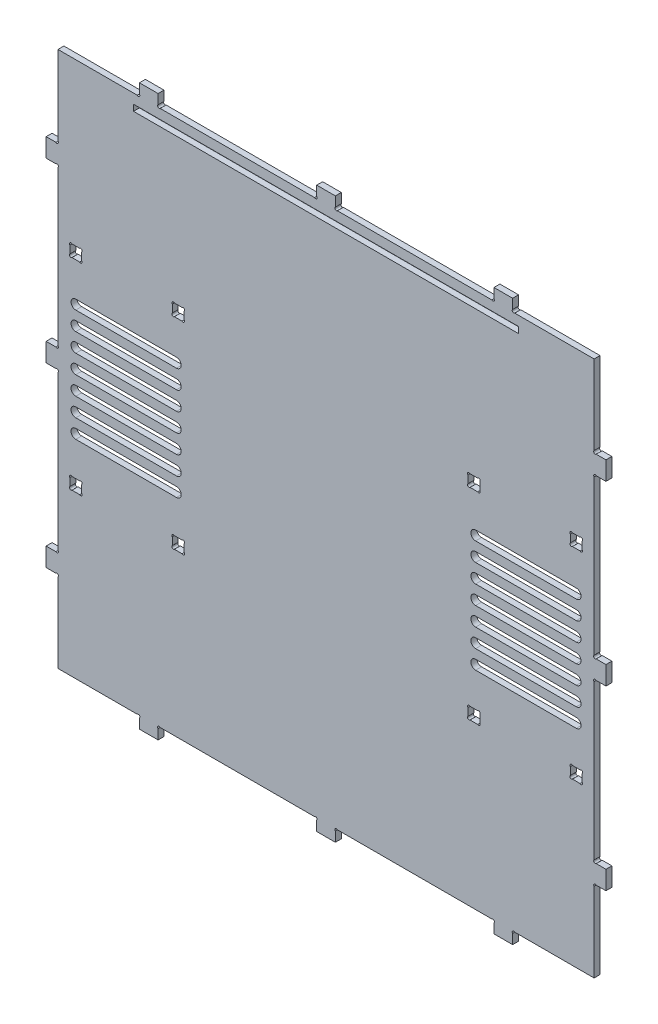
from build123d import *

# Parameters (mm, degrees)
SKETCH15_W                     = 287.299999948
SKETCH15_H                     = 287.299999948
BOSS_EXTRUDE10_DEPTH           = 3.175
SKETCH18_W                     = 206.375
SKETCH18_H                     = 3.302
SLOT_DEPTH                     = 3.175
SKETCH24_W                     = 10.000000066
SKETCH24_H                     = 6.35
TOOTH_DEPTH                    = 3.175
TOOTH_DB_D                     = 1.5875
TOOTH_PATTERN_SIDE_DEPTH       = 3.175
TOOTH_PATTERN_SIDE_2_DEPTH     = 3.175
TOOTH_PATTERN_FULL_DEPTH       = 3.175
TOOTH_PATTERN_FULL_2_DEPTH     = 3.175
CUT_EXTRUDE2_DEPTH             = 6.35
SKETCH37_W                     = 6.35
SKETCH37_H                     = 6.35
CUT_EXTRUDE3_DEPTH             = 6.35
F_1_16_0_0625_DIAMETER_HOLE1_D = 1.5875


# Read off the part's stored shape, not the designer's step: tooth_pattern_side, tooth_pattern_full
with BuildPart() as part:
    # Sketch15 → Boss-Extrude10 (new body)
    with BuildSketch(Plane.XY):
        with Locations((143.649999974, 143.649999974)):
            Rectangle(SKETCH15_W, SKETCH15_H)
    extrude(amount=BOSS_EXTRUDE10_DEPTH)

    # Sketch18 → slot (cut)
    with BuildSketch(Plane.XY.offset(3.175)):
        with Locations((143.649999974, 280.465831498)):
            Rectangle(SKETCH18_W, SKETCH18_H)
    extrude(amount=-SLOT_DEPTH, mode=Mode.SUBTRACT)

    # Sketch24 → tooth (add)
    with BuildSketch(Plane.XY):
        with Locations((143.649999974, 290.474999948)):
            Rectangle(SKETCH24_W, SKETCH24_H)
    extrude(amount=TOOTH_DEPTH)

    # tooth_db (through all)
    with Locations(Plane.XY.offset(3.175)):
        with Locations((138.091199941, 287.858799948), (149.208800007, 287.858799948)):
            Hole(TOOTH_DB_D / 2)

    # tooth_pattern_side outline → tooth_pattern_side (cut)
    with BuildSketch(Plane.XY):
        with BuildLine():
            Line((54.772521235, 287.299999948), (53.645078778, 287.299999948))
            ThreePointArc((53.645078778, 287.299999948), (54.208800007, 287.065049947), (54.772521235, 287.299999948))
        make_face()
        with BuildLine():
            ThreePointArc((42.527478713, 287.299999948), (43.091199941, 287.065049947), (43.65492117, 287.299999948))
            Line((43.65492117, 287.299999948), (42.527478713, 287.299999948))
        make_face()
        with BuildLine():
            Line((244.772521235, 287.299999948), (243.645078778, 287.299999948))
            ThreePointArc((243.645078778, 287.299999948), (244.208800007, 287.065049947), (244.772521235, 287.299999948))
        make_face()
        with BuildLine():
            ThreePointArc((232.527478713, 287.299999948), (233.091199941, 287.065049947), (233.65492117, 287.299999948))
            Line((233.65492117, 287.299999948), (232.527478713, 287.299999948))
        make_face()
    extrude(amount=TOOTH_PATTERN_SIDE_DEPTH, mode=Mode.SUBTRACT)

    # tooth_pattern_side 2 outline → tooth_pattern_side 2 (add)
    with BuildSketch(Plane.XY):
        with BuildLine():
            Line((53.650000007, 293.649999948), (43.649999941, 293.649999948))
            Line((43.649999941, 293.649999948), (43.649999941, 288.422521176))
            ThreePointArc((43.649999941, 288.422521176), (43.884942314, 287.862279782), (43.65492117, 287.299999948))
            Line((43.65492117, 287.299999948), (53.645078778, 287.299999948))
            ThreePointArc((53.645078778, 287.299999948), (53.415057634, 287.862279782), (53.650000007, 288.422521176))
            Line((53.650000007, 288.422521176), (53.650000007, 293.649999948))
        make_face()
        with BuildLine():
            Line((243.650000007, 293.649999948), (233.649999941, 293.649999948))
            Line((233.649999941, 293.649999948), (233.649999941, 288.422521176))
            ThreePointArc((233.649999941, 288.422521176), (233.884942314, 287.862279782), (233.65492117, 287.299999948))
            Line((233.65492117, 287.299999948), (243.645078778, 287.299999948))
            ThreePointArc((243.645078778, 287.299999948), (243.415057634, 287.862279782), (243.650000007, 288.422521176))
            Line((243.650000007, 288.422521176), (243.650000007, 293.649999948))
        make_face()
    extrude(amount=TOOTH_PATTERN_SIDE_2_DEPTH)

    # tooth_pattern_full outline → tooth_pattern_full (cut)
    with BuildSketch(Plane.XY):
        with BuildLine():
            Line((0, 244.772521235), (0, 243.645078778))
            ThreePointArc((0, 243.645078778), (0.234950001, 244.208800007), (0, 244.772521235))
        make_face()
        with BuildLine():
            Line((0, 233.65492117), (0, 232.527478713))
            ThreePointArc((0, 232.527478713), (0.234950001, 233.091199941), (0, 233.65492117))
        make_face()
        with BuildLine():
            Line((0, 149.772521235), (0, 148.645078778))
            ThreePointArc((0, 148.645078778), (0.234950001, 149.208800007), (0, 149.772521235))
        make_face()
        with BuildLine():
            Line((0, 138.65492117), (0, 137.527478713))
            ThreePointArc((0, 137.527478713), (0.234950001, 138.091199941), (0, 138.65492117))
        make_face()
        with BuildLine():
            Line((0, 54.772521235), (0, 53.645078778))
            ThreePointArc((0, 53.645078778), (0.234950001, 54.208800007), (0, 54.772521235))
        make_face()
        with BuildLine():
            Line((0, 43.65492117), (0, 42.527478713))
            ThreePointArc((0, 42.527478713), (0.234950001, 43.091199941), (0, 43.65492117))
        make_face()
        with BuildLine():
            Line((42.527478713, 0), (43.65492117, 0))
            ThreePointArc((43.65492117, 0), (43.091199941, 0.234950001), (42.527478713, 0))
        make_face()
        with BuildLine():
            Line((53.645078778, 0), (54.772521235, 0))
            ThreePointArc((54.772521235, 0), (54.208800007, 0.234950001), (53.645078778, 0))
        make_face()
        with BuildLine():
            Line((137.527478713, 0), (138.65492117, 0))
            ThreePointArc((138.65492117, 0), (138.091199941, 0.234950001), (137.527478713, 0))
        make_face()
        with BuildLine():
            ThreePointArc((287.299999948, 244.772521235), (287.065049947, 244.208800007), (287.299999948, 243.645078778))
            Line((287.299999948, 243.645078778), (287.299999948, 244.772521235))
        make_face()
        with BuildLine():
            ThreePointArc((287.299999948, 233.65492117), (287.065049947, 233.091199941), (287.299999948, 232.527478713))
            Line((287.299999948, 232.527478713), (287.299999948, 233.65492117))
        make_face()
        with BuildLine():
            ThreePointArc((287.299999948, 149.772521235), (287.065049947, 149.208800007), (287.299999948, 148.645078778))
            Line((287.299999948, 148.645078778), (287.299999948, 149.772521235))
        make_face()
        with BuildLine():
            ThreePointArc((287.299999948, 138.65492117), (287.065049947, 138.091199941), (287.299999948, 137.527478713))
            Line((287.299999948, 137.527478713), (287.299999948, 138.65492117))
        make_face()
        with BuildLine():
            ThreePointArc((287.299999948, 54.772521235), (287.065049947, 54.208800007), (287.299999948, 53.645078778))
            Line((287.299999948, 53.645078778), (287.299999948, 54.772521235))
        make_face()
        with BuildLine():
            ThreePointArc((287.299999948, 43.65492117), (287.065049947, 43.091199941), (287.299999948, 42.527478713))
            Line((287.299999948, 42.527478713), (287.299999948, 43.65492117))
        make_face()
        with BuildLine():
            ThreePointArc((244.772521235, 0), (244.208800007, 0.234950001), (243.645078778, 0))
            Line((243.645078778, 0), (244.772521235, 0))
        make_face()
        with BuildLine():
            ThreePointArc((233.65492117, 0), (233.091199941, 0.234950001), (232.527478713, 0))
            Line((232.527478713, 0), (233.65492117, 0))
        make_face()
        with BuildLine():
            ThreePointArc((149.772521235, 0), (149.208800007, 0.234950001), (148.645078778, 0))
            Line((148.645078778, 0), (149.772521235, 0))
        make_face()
    extrude(amount=TOOTH_PATTERN_FULL_DEPTH, mode=Mode.SUBTRACT)

    # tooth_pattern_full 2 outline → tooth_pattern_full 2 (add)
    with BuildSketch(Plane.XY):
        with BuildLine():
            ThreePointArc((-1.122521228, 233.649999941), (-0.562279834, 233.884942314), (0, 233.65492117))
            Line((0, 233.65492117), (0, 243.645078778))
            ThreePointArc((0, 243.645078778), (-0.562279834, 243.415057634), (-1.122521228, 243.650000007))
            Line((-1.122521228, 243.650000007), (-6.35, 243.650000007))
            Line((-6.35, 243.650000007), (-6.35, 233.649999941))
            Line((-6.35, 233.649999941), (-1.122521228, 233.649999941))
        make_face()
        with BuildLine():
            ThreePointArc((-1.122521228, 138.649999941), (-0.562279834, 138.884942314), (0, 138.65492117))
            Line((0, 138.65492117), (0, 148.645078778))
            ThreePointArc((0, 148.645078778), (-0.562279834, 148.415057634), (-1.122521228, 148.650000007))
            Line((-1.122521228, 148.650000007), (-6.35, 148.650000007))
            Line((-6.35, 148.650000007), (-6.35, 138.649999941))
            Line((-6.35, 138.649999941), (-1.122521228, 138.649999941))
        make_face()
        with BuildLine():
            ThreePointArc((-1.122521228, 43.649999941), (-0.562279834, 43.884942314), (0, 43.65492117))
            Line((0, 43.65492117), (0, 53.645078778))
            ThreePointArc((0, 53.645078778), (-0.562279834, 53.415057634), (-1.122521228, 53.650000007))
            Line((-1.122521228, 53.650000007), (-6.35, 53.650000007))
            Line((-6.35, 53.650000007), (-6.35, 43.649999941))
            Line((-6.35, 43.649999941), (-1.122521228, 43.649999941))
        make_face()
        with BuildLine():
            ThreePointArc((53.650000007, -1.122521228), (53.415057634, -0.562279834), (53.645078778, 0))
            Line((53.645078778, 0), (43.65492117, 0))
            ThreePointArc((43.65492117, 0), (43.884942314, -0.562279834), (43.649999941, -1.122521228))
            Line((43.649999941, -1.122521228), (43.649999941, -6.35))
            Line((43.649999941, -6.35), (53.650000007, -6.35))
            Line((53.650000007, -6.35), (53.650000007, -1.122521228))
        make_face()
        with BuildLine():
            Line((287.299999948, 243.645078778), (287.299999948, 233.65492117))
            ThreePointArc((287.299999948, 233.65492117), (287.862279782, 233.884942314), (288.422521176, 233.649999941))
            Line((288.422521176, 233.649999941), (293.649999948, 233.649999941))
            Line((293.649999948, 233.649999941), (293.649999948, 243.650000007))
            Line((293.649999948, 243.650000007), (288.422521176, 243.650000007))
            ThreePointArc((288.422521176, 243.650000007), (287.862279782, 243.415057634), (287.299999948, 243.645078778))
        make_face()
        with BuildLine():
            Line((287.299999948, 148.645078778), (287.299999948, 138.65492117))
            ThreePointArc((287.299999948, 138.65492117), (287.862279782, 138.884942314), (288.422521176, 138.649999941))
            Line((288.422521176, 138.649999941), (293.649999948, 138.649999941))
            Line((293.649999948, 138.649999941), (293.649999948, 148.650000007))
            Line((293.649999948, 148.650000007), (288.422521176, 148.650000007))
            ThreePointArc((288.422521176, 148.650000007), (287.862279782, 148.415057634), (287.299999948, 148.645078778))
        make_face()
        with BuildLine():
            Line((287.299999948, 53.645078778), (287.299999948, 43.65492117))
            ThreePointArc((287.299999948, 43.65492117), (287.862279782, 43.884942314), (288.422521176, 43.649999941))
            Line((288.422521176, 43.649999941), (293.649999948, 43.649999941))
            Line((293.649999948, 43.649999941), (293.649999948, 53.650000007))
            Line((293.649999948, 53.650000007), (288.422521176, 53.650000007))
            ThreePointArc((288.422521176, 53.650000007), (287.862279782, 53.415057634), (287.299999948, 53.645078778))
        make_face()
        with BuildLine():
            Line((243.645078778, 0), (233.65492117, 0))
            ThreePointArc((233.65492117, 0), (233.884942314, -0.562279834), (233.649999941, -1.122521228))
            Line((233.649999941, -1.122521228), (233.649999941, -6.35))
            Line((233.649999941, -6.35), (243.650000007, -6.35))
            Line((243.650000007, -6.35), (243.650000007, -1.122521228))
            ThreePointArc((243.650000007, -1.122521228), (243.415057634, -0.562279834), (243.645078778, 0))
        make_face()
        with BuildLine():
            Line((148.650000007, -6.35), (148.650000007, -1.122521228))
            ThreePointArc((148.650000007, -1.122521228), (148.415057634, -0.562279834), (148.645078778, 0))
            Line((148.645078778, 0), (138.65492117, 0))
            ThreePointArc((138.65492117, 0), (138.884942314, -0.562279834), (138.649999941, -1.122521228))
            Line((138.649999941, -1.122521228), (138.649999941, -6.35))
            Line((138.649999941, -6.35), (148.650000007, -6.35))
        make_face()
    extrude(amount=TOOTH_PATTERN_FULL_2_DEPTH)

    # Sketch36 → Cut-Extrude2 (cut)
    with BuildSketch(Plane.XY.offset(3.175)):
        with BuildLine():
            Line((277.774999948, 176.189999974), (223.799999948, 176.189999974))
            ThreePointArc((223.799999948, 176.189999974), (221.259999948, 173.649999974), (223.799999948, 171.109999974))
            Line((223.799999948, 171.109999974), (277.774999948, 171.109999974))
            ThreePointArc((277.774999948, 171.109999974), (280.314999948, 173.649999974), (277.774999948, 176.189999974))
        make_face()
        with BuildLine():
            Line((277.774999948, 166.189999974), (223.799999948, 166.189999974))
            ThreePointArc((223.799999948, 166.189999974), (221.259999948, 163.649999974), (223.799999948, 161.109999974))
            Line((223.799999948, 161.109999974), (277.774999948, 161.109999974))
            ThreePointArc((277.774999948, 161.109999974), (280.314999948, 163.649999974), (277.774999948, 166.189999974))
        make_face()
        with BuildLine():
            Line((9.525, 176.189999974), (63.5, 176.189999974))
            ThreePointArc((63.5, 176.189999974), (66.04, 173.649999974), (63.5, 171.109999974))
            Line((63.5, 171.109999974), (9.525, 171.109999974))
            ThreePointArc((9.525, 171.109999974), (6.985, 173.649999974), (9.525, 176.189999974))
        make_face()
        with BuildLine():
            Line((277.774999948, 156.189999974), (223.799999948, 156.189999974))
            ThreePointArc((223.799999948, 156.189999974), (221.259999948, 153.649999974), (223.799999948, 151.109999974))
            Line((223.799999948, 151.109999974), (277.774999948, 151.109999974))
            ThreePointArc((277.774999948, 151.109999974), (280.314999948, 153.649999974), (277.774999948, 156.189999974))
        make_face()
        with BuildLine():
            Line((9.525, 166.189999974), (63.5, 166.189999974))
            ThreePointArc((63.5, 166.189999974), (66.04, 163.649999974), (63.5, 161.109999974))
            Line((63.5, 161.109999974), (9.525, 161.109999974))
            ThreePointArc((9.525, 161.109999974), (6.985, 163.649999974), (9.525, 166.189999974))
        make_face()
        with BuildLine():
            Line((9.525, 156.189999974), (63.5, 156.189999974))
            ThreePointArc((63.5, 156.189999974), (66.04, 153.649999974), (63.5, 151.109999974))
            Line((63.5, 151.109999974), (9.525, 151.109999974))
            ThreePointArc((9.525, 151.109999974), (6.985, 153.649999974), (9.525, 156.189999974))
        make_face()
        with BuildLine():
            Line((9.525, 146.189999974), (63.5, 146.189999974))
            ThreePointArc((63.5, 146.189999974), (66.04, 143.649999974), (63.5, 141.109999974))
            Line((63.5, 141.109999974), (9.525, 141.109999974))
            ThreePointArc((9.525, 141.109999974), (6.985, 143.649999974), (9.525, 146.189999974))
        make_face()
        with BuildLine():
            Line((9.525, 136.189999974), (63.5, 136.189999974))
            ThreePointArc((63.5, 136.189999974), (66.04, 133.649999974), (63.5, 131.109999974))
            Line((63.5, 131.109999974), (9.525, 131.109999974))
            ThreePointArc((9.525, 131.109999974), (6.985, 133.649999974), (9.525, 136.189999974))
        make_face()
        with BuildLine():
            Line((9.525, 126.189999974), (63.5, 126.189999974))
            ThreePointArc((63.5, 126.189999974), (66.04, 123.649999974), (63.5, 121.109999974))
            Line((63.5, 121.109999974), (9.525, 121.109999974))
            ThreePointArc((9.525, 121.109999974), (6.985, 123.649999974), (9.525, 126.189999974))
        make_face()
        with BuildLine():
            Line((9.525, 116.189999974), (63.5, 116.189999974))
            ThreePointArc((63.5, 116.189999974), (66.04, 113.649999974), (63.5, 111.109999974))
            Line((63.5, 111.109999974), (9.525, 111.109999974))
            ThreePointArc((9.525, 111.109999974), (6.985, 113.649999974), (9.525, 116.189999974))
        make_face()
        with BuildLine():
            Line((277.774999948, 146.189999974), (223.799999948, 146.189999974))
            ThreePointArc((223.799999948, 146.189999974), (221.259999948, 143.649999974), (223.799999948, 141.109999974))
            Line((223.799999948, 141.109999974), (277.774999948, 141.109999974))
            ThreePointArc((277.774999948, 141.109999974), (280.314999948, 143.649999974), (277.774999948, 146.189999974))
        make_face()
        with BuildLine():
            Line((277.774999948, 136.189999974), (223.799999948, 136.189999974))
            ThreePointArc((223.799999948, 136.189999974), (221.259999948, 133.649999974), (223.799999948, 131.109999974))
            Line((223.799999948, 131.109999974), (277.774999948, 131.109999974))
            ThreePointArc((277.774999948, 131.109999974), (280.314999948, 133.649999974), (277.774999948, 136.189999974))
        make_face()
        with BuildLine():
            Line((277.774999948, 126.189999974), (223.799999948, 126.189999974))
            ThreePointArc((223.799999948, 126.189999974), (221.259999948, 123.649999974), (223.799999948, 121.109999974))
            Line((223.799999948, 121.109999974), (277.774999948, 121.109999974))
            ThreePointArc((277.774999948, 121.109999974), (280.314999948, 123.649999974), (277.774999948, 126.189999974))
        make_face()
        with BuildLine():
            Line((277.774999948, 116.189999974), (223.799999948, 116.189999974))
            ThreePointArc((223.799999948, 116.189999974), (221.259999948, 113.649999974), (223.799999948, 111.109999974))
            Line((223.799999948, 111.109999974), (277.774999948, 111.109999974))
            ThreePointArc((277.774999948, 111.109999974), (280.314999948, 113.649999974), (277.774999948, 116.189999974))
        make_face()
    extrude(amount=-CUT_EXTRUDE2_DEPTH, mode=Mode.SUBTRACT)

    # Sketch37 → Cut-Extrude3 (cut)
    with BuildSketch(Plane.XY.offset(3.175)):
        with Locations((9.559050986, 197.624999974)):
            Rectangle(SKETCH37_W, SKETCH37_H)
    cut_extrude3 = extrude(amount=-CUT_EXTRUDE3_DEPTH, mode=Mode.SUBTRACT)

    # 1/16 (0.0625) Diameter Hole1 (through all)
    with Locations(Plane.XY.offset(3.175)):
        with Locations((12.175250986, 195.008799974), (9.559050986, 197.624999974), (12.175250986, 200.241199974), (6.942850986, 195.008799974), (6.942850986, 200.241199974)):
            f_1_16_0_0625_diameter_hole1 = Hole(F_1_16_0_0625_DIAMETER_HOLE1_D / 2)

    # Sketch-Pattern1: Cut-Extrude3, 1/16 (0.0625) Diameter Hole1 at 7 more places
    with Locations((54.864, 0, 0), (54.864, -107.95, 0), (0, -107.95, 0), (213.317898, 0, 0), (268.181898, 0, 0), (268.181898, -107.95, 0), (213.317898, -107.95, 0)):
        add(cut_extrude3, mode=Mode.SUBTRACT)
        add(f_1_16_0_0625_diameter_hole1, mode=Mode.SUBTRACT)


solid = part.part
